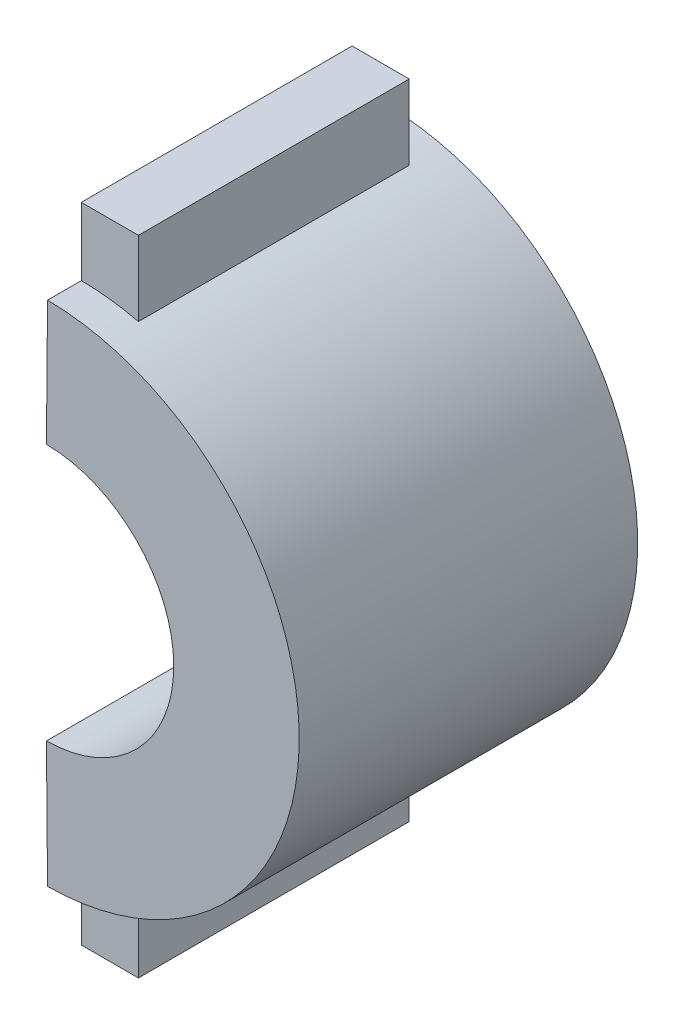
from build123d import *

# Parameters (mm, degrees)
REVOLVE_PROFILE_1_W   = 29.65
REVOLVE_PROFILE_1_H   = 80
REVOLVE_1_ANGLE       = 179
REVOLVE_INDEX_1_ANGLE = 89.5
EXTRUDE_START         = -32
EXTRUDE_SKETCH_1_W    = 13.5
EXTRUDE_SKETCH_1_H    = 20
EXTRUDE_1_DEPTH       = 64
EXTRUDE_SKETCH_2_W    = 13.5
EXTRUDE_SKETCH_2_H    = 20
EXTRUDE_2_DEPTH       = 64


with BuildPart() as part:
    # Revolve profile 1 → Revolve 1 (revolve)
    with BuildSketch(Plane(origin=(0, 0, 0), x_dir=(1, 0, 0), z_dir=(0, 1, 0))):
        with Locations((45.175, 0)):
            Rectangle(REVOLVE_PROFILE_1_W, REVOLVE_PROFILE_1_H)
    revolve(axis=Axis((0, 0, -45), (0, 0, 1)), revolution_arc=REVOLVE_1_ANGLE)


with BuildPart() as part_1:
    # Revolve index 1: moved
    add(part.part.rotate(Axis((0, 0, 0), (0, 0, -1)), REVOLVE_INDEX_1_ANGLE))


with BuildPart() as body_2:
    # Extrude sketch 1 → Extrude 1 (new body)
    with BuildSketch(Plane.XY.offset(EXTRUDE_START)):
        with Locations((7.25, 66)):
            Rectangle(EXTRUDE_SKETCH_1_W, EXTRUDE_SKETCH_1_H)
    extrude(amount=EXTRUDE_1_DEPTH)


with BuildPart() as body_3:
    # Extrude sketch 2 → Extrude 2 (new body)
    with BuildSketch(Plane.XY.offset(EXTRUDE_START)):
        with Locations((7.25, -66)):
            Rectangle(EXTRUDE_SKETCH_2_W, EXTRUDE_SKETCH_2_H)
    extrude(amount=EXTRUDE_2_DEPTH)

    # Combine (weld / assembly of features): union body 2, part
    add(body_2.part)
    add(part_1.part)


solid = body_3.part
